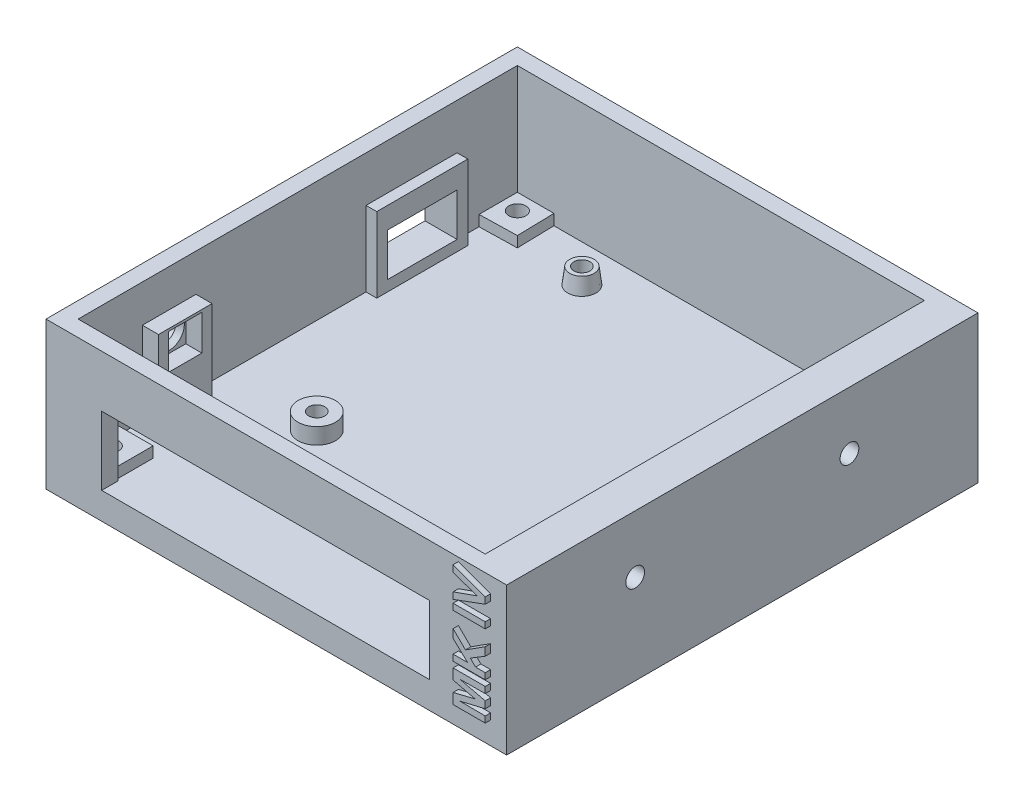
from build123d import *

# Parameters (mm, degrees)
SKETCH1_W            = 82
SKETCH1_H            = 88
BOSS_EXTRUDE1_DEPTH  = 5
SKETCH2_W            = 82
SKETCH2_H            = 88
SKETCH2_W_2          = 76
SKETCH2_H_2          = 82
BOSS_EXTRUDE2_DEPTH  = 22.5
SKETCH_1_R           = 3.5
SKETCH_1_R_2         = 1.5
BOSS_EXTRUDE3_DEPTH  = 3
SKETCH4_W            = 13
SKETCH4_H            = 12
CUT_EXTRUDE1_DEPTH   = 3
SKETCH7_R            = 1.6
CUT_EXTRUDE3_DEPTH   = 67.130552697
CUT_EXTRUDE4_DEPTH   = 3.5
SKETCH10_W           = 17
SKETCH10_H           = 16
SKETCH10_W_2         = 13
SKETCH10_H_2         = 12
BOSS_EXTRUDE6_DEPTH  = 2
CHAMFER1_SIZE        = 10
CHAMFER1_SIZE_2      = 1.227845609
SKETCH11_R           = 1.5
CUT_EXTRUDE5_DEPTH   = 65.212537717
SKETCH12_W           = 61.2
SKETCH12_H           = 12.8
CUT_EXTRUDE6_DEPTH   = 3
SKETCH13_R           = 1.75
CUT_EXTRUDE7_DEPTH   = 3
BOSS_EXTRUDE7_START  = 4
SKETCH14_W           = 88
SKETCH14_H           = 27.5
SKETCH14_R           = 1.75
BOSS_EXTRUDE7_DEPTH  = 4
SKETCH15_R           = 3.75
CUT_EXTRUDE8_DEPTH   = 3
CUT_EXTRUDE9_REACH   = 102.44
SKETCH16_R           = 2.25
SKETCH17_W           = 10
SKETCH17_H           = 15.5
SKETCH17_W_2         = 6.2
SKETCH17_H_2         = 6.6
BOSS_EXTRUDE8_DEPTH  = 3
CHAMFER2_SIZE        = 1
CHAMFER2_SIZE2       = 0.577350269
SKETCH20_R           = 5
SKETCH20_R_2         = 3
BOSS_EXTRUDE10_DEPTH = 1
FILLET3_R            = 2
SKETCH21_W           = 5
SKETCH21_H           = 13
BOSS_EXTRUDE11_DEPTH = 2
SKETCH22_W           = 6
SKETCH22_H           = 1.153846154
BOSS_EXTRUDE12_DEPTH = 1
SKETCH27_W           = 5
SKETCH27_H           = 13
BOSS_EXTRUDE17_DEPTH = 2
SKETCH23_W           = 7
SKETCH23_H           = 7
SKETCH23_R           = 1.6
BOSS_EXTRUDE13_DEPTH = 2
SKETCH25_W           = 17
SKETCH25_H           = 12
SKETCH25_W_2         = 13
SKETCH25_H_2         = 8
BOSS_EXTRUDE15_DEPTH = 1
FILLET4_R            = 2


with BuildPart() as part:
    # Sketch1 → Boss-Extrude1 (new body)
    with BuildSketch(Plane(origin=(0, 0, 0), x_dir=(1, 0, 0), z_dir=(0, 1, 0))):
        Rectangle(SKETCH1_W, SKETCH1_H)
    extrude(amount=BOSS_EXTRUDE1_DEPTH)

    # Sketch2 → Boss-Extrude2 (add)
    with BuildSketch(Plane(origin=(0, 5, 0), x_dir=(1, 0, 0), z_dir=(0, 1, 0))):
        Rectangle(SKETCH2_W, SKETCH2_H)
        Rectangle(SKETCH2_W_2, SKETCH2_H_2, mode=Mode.SUBTRACT)
    extrude(amount=BOSS_EXTRUDE2_DEPTH)

    # Эскиз1 → Boss-Extrude3 (add)
    # profile 1 of 4: a face of its own
    with BuildSketch(Plane(origin=(0, 5, 0), x_dir=(1, 0, 0), z_dir=(0, 1, 0))):
        with Locations(Location((-20.3, -14.15, 0), (0, 0, 90))):
            Circle(SKETCH_1_R)
        with Locations(Location((-20.3, -14.15, 0), (0, 0, 270))):
            Circle(SKETCH_1_R_2, mode=Mode.SUBTRACT)
    # profile 2 of 4: a face of its own
    with BuildSketch(Plane(origin=(0, 5, 0), x_dir=(1, 0, 0), z_dir=(0, 1, 0))):
        with Locations(Location((-19, 34.05, 0), (0, 0, 90))):
            Circle(SKETCH_1_R)
        with Locations(Location((-19, 34.05, 0), (0, 0, 270))):
            Circle(SKETCH_1_R_2, mode=Mode.SUBTRACT)
    # profile 3 of 4: a face of its own
    with BuildSketch(Plane(origin=(0, 5, 0), x_dir=(1, 0, 0), z_dir=(0, 1, 0))):
        with Locations(Location((31.8, 18.85, 0), (0, 0, 90))):
            Circle(SKETCH_1_R)
        with Locations(Location((31.8, 18.85, 0), (0, 0, 270))):
            Circle(SKETCH_1_R_2, mode=Mode.SUBTRACT)
    # profile 4 of 4: a face of its own
    with BuildSketch(Plane(origin=(0, 5, 0), x_dir=(1, 0, 0), z_dir=(0, 1, 0))):
        with Locations(Location((31.8, -9.05, 0), (0, 0, 90))):
            Circle(SKETCH_1_R)
        with Locations(Location((31.8, -9.05, 0), (0, 0, 270))):
            Circle(SKETCH_1_R_2, mode=Mode.SUBTRACT)
    extrude(amount=BOSS_EXTRUDE3_DEPTH)

    # Sketch4 → Cut-Extrude1 (cut)
    with BuildSketch(Plane.ZY.offset(41)):
        with Locations((-21.25, 11)):
            Rectangle(SKETCH4_W, SKETCH4_H)
    extrude(amount=-CUT_EXTRUDE1_DEPTH, mode=Mode.SUBTRACT)

    # Sketch7 → Cut-Extrude3 (cut, through all)
    with BuildSketch(Plane.XZ):
        with Locations(Location((35, -38, 0), (0, 0, 270))):
            Circle(SKETCH7_R)
        with Locations(Location((-35, -38, 0), (0, 0, 270))):
            Circle(SKETCH7_R)
        with Locations(Location((-35, 38, 0), (0, 0, 270))):
            Circle(SKETCH7_R)
        with Locations(Location((35, 38, 0), (0, 0, 270))):
            Circle(SKETCH7_R)
    extrude(amount=-CUT_EXTRUDE3_DEPTH, mode=Mode.SUBTRACT)

    # Sketch8 → Cut-Extrude4 (cut)
    with BuildSketch(Plane.XZ):
        Polygon((33.375, 35.185417438), (36.625, 35.185417438), (38.25, 38), (36.625, 40.814582562), (33.375, 40.814582562), (31.75, 38), align=None)
        Polygon((33.375, -35.185417438), (31.75, -38), (33.375, -40.814582562), (36.625, -40.814582562), (38.25, -38), (36.625, -35.185417438), align=None)
        Polygon((-36.625, -35.185417438), (-38.25, -38), (-36.625, -40.814582562), (-33.375, -40.814582562), (-31.75, -38), (-33.375, -35.185417438), align=None)
        Polygon((-36.625, 35.185417438), (-33.375, 35.185417438), (-31.75, 38), (-33.375, 40.814582562), (-36.625, 40.814582562), (-38.25, 38), align=None)
    extrude(amount=-CUT_EXTRUDE4_DEPTH, mode=Mode.SUBTRACT)

    # Sketch10 → Boss-Extrude6 (add)
    with BuildSketch(Plane(origin=(-38, 0, 0), x_dir=(0, 0, -1), z_dir=(1, 0, 0))):
        with Locations((21.25, 11)):
            Rectangle(SKETCH10_W, SKETCH10_H)
        with Locations((21.25, 11)):
            Rectangle(SKETCH10_W_2, SKETCH10_H_2, mode=Mode.SUBTRACT)
    extrude(amount=BOSS_EXTRUDE6_DEPTH)

    # Chamfer1
    # the kernel refuses this chamfer: 10, 1.227845609 mm, written as the material it takes off along each edge
    with BuildSketch(Plane(origin=(-19, 8, -34.05), x_dir=(0, 0, -1), z_dir=(1, 0, 0))) as chamfer1_piece_1_section:
        Polygon((3.5, -CHAMFER1_SIZE), (3.5 - CHAMFER1_SIZE_2, 0), (3.5, 0), align=None)
    chamfer1_piece_1 = revolve(axis=Axis((-19, 8, -34.05), (0, 1, 0)), mode=Mode.PRIVATE)
    chamfer1_piece_1 = split(chamfer1_piece_1, bisect_by=Plane(origin=(-19, 5, -31.575672909), z_dir=(0, 1, 0)), keep=Keep.TOP, mode=Mode.PRIVATE)
    add(chamfer1_piece_1, mode=Mode.SUBTRACT)

    # Sketch11 → Cut-Extrude5 (cut, through all)
    with BuildSketch(Plane(origin=(0, 5, 0), x_dir=(1, 0, 0), z_dir=(0, 1, 0))):
        with Locations(Location((-20.3, -14.15, 0), (0, 0, 270))):
            Circle(SKETCH11_R)
        with Locations(Location((-19, 34.05, 0), (0, 0, 270))):
            Circle(SKETCH11_R)
        with Locations(Location((31.8, -9.05, 0), (0, 0, 270))):
            Circle(SKETCH11_R)
        with Locations(Location((31.8, 18.85, 0), (0, 0, 270))):
            Circle(SKETCH11_R)
    extrude(amount=-CUT_EXTRUDE5_DEPTH, mode=Mode.SUBTRACT)

    # Sketch12 → Cut-Extrude6 (cut)
    with BuildSketch(Plane.XY.offset(44)):
        with Locations((0, 11.4)):
            Rectangle(SKETCH12_W, SKETCH12_H)
    extrude(amount=-CUT_EXTRUDE6_DEPTH, mode=Mode.SUBTRACT)

    # Sketch13 → Cut-Extrude7 (cut)
    with BuildSketch(Plane(origin=(41, 0, 0), x_dir=(0, 0, -1), z_dir=(1, 0, 0))):
        with Locations((-20, 16.75)):
            Circle(SKETCH13_R)
        with Locations((20, 16.75)):
            Circle(SKETCH13_R)
    extrude(amount=-CUT_EXTRUDE7_DEPTH, mode=Mode.SUBTRACT)

    # Sketch14 → Boss-Extrude7 (add)
    with BuildSketch(Plane(origin=(41, 0, 0), x_dir=(0, 0, -1), z_dir=(1, 0, 0)).offset(BOSS_EXTRUDE7_START)):
        with Locations((0, 13.75)):
            Rectangle(SKETCH14_W, SKETCH14_H)
        with Locations((-20, 16.75)):
            Circle(SKETCH14_R, mode=Mode.SUBTRACT)
        with Locations((20, 16.75)):
            Circle(SKETCH14_R, mode=Mode.SUBTRACT)
    extrude(amount=-BOSS_EXTRUDE7_DEPTH)

    # Sketch15 → Cut-Extrude8 (cut)
    with BuildSketch(Plane.ZY.offset(-38)):
        with Locations((20, 16.75)):
            Circle(SKETCH15_R)
        with Locations((-20, 16.75)):
            Circle(SKETCH15_R)
    extrude(amount=-CUT_EXTRUDE8_DEPTH, mode=Mode.SUBTRACT)

    # Sketch16 → Cut-Extrude9 (cut, up to next)
    with BuildSketch(Plane.ZY.offset(41), mode=Mode.PRIVATE) as cut_extrude9_sk1:
        with Locations((24, 16.75)):
            Circle(SKETCH16_R)
    cut_extrude9_tool1 = extrude(cut_extrude9_sk1.sketch, amount=-CUT_EXTRUDE9_REACH, mode=Mode.PRIVATE) & part.part
    add(cut_extrude9_tool1.solids().sort_by_distance((-41, 16.75, 24))[0], mode=Mode.SUBTRACT)

    # Sketch17 → Boss-Extrude8 (add)
    with BuildSketch(Plane(origin=(-38, 0, 0), x_dir=(0, 0, -1), z_dir=(1, 0, 0))):
        with Locations((-24, 12.75)):
            Rectangle(SKETCH17_W, SKETCH17_H)
        with Locations((-24, 16.75)):
            Rectangle(SKETCH17_W_2, SKETCH17_H_2, mode=Mode.SUBTRACT)
    extrude(amount=BOSS_EXTRUDE8_DEPTH)

    # Chamfer2
    chamfer2_edges = [part.edges().sort_by_distance(p)[0] for p in [
        (-38, 16.75, 21.75),
    ]]
    chamfer2_side = [part.faces().sort_by_distance(p)[0] for p in [
        (-39.5, 16.75, 21.75),
    ]]
    chamfer(chamfer2_edges, length=CHAMFER2_SIZE, length2=CHAMFER2_SIZE2, reference=chamfer2_side[0])

    # Sketch20 → Boss-Extrude10 (add)
    with BuildSketch(Plane.ZY.offset(41)):
        with Locations(Location((24, 16.75, 0), (0, 0, 180))):
            Circle(SKETCH20_R)
        with Locations((24, 16.75)):
            Circle(SKETCH20_R_2, mode=Mode.SUBTRACT)
    extrude(amount=BOSS_EXTRUDE10_DEPTH)

    # Fillet3
    # the kernel refuses this fillet: 2 mm, written as the material it adds along each edge
    with BuildSketch(Plane(origin=(-41, 16.75, 24), x_dir=(0, 0, -1), z_dir=(0, 1, 0))) as fillet3_piece_1:
        with BuildLine():
            CenterArc((6.732050808, 2), FILLET3_R, 210, 60)
            Line((6.732050808, 0), (6.732050808, -0.04))
            Line((6.732050808, -0.04), (5, -0.04))
            Line((5, -0.04), (4.96, 0))
            ThreePointArc((4.96, 0), (4.96, 0.5), (4.965358984, 0.98))
            Line((4.965358984, 0.98), (5, 1))
        make_face()
    revolve(axis=Axis((-41, 16.75, 24), (-1, 0, 0)))

    # Sketch21 → Boss-Extrude11 (add)
    with BuildSketch(Plane(origin=(0, 5, 0), x_dir=(1, 0, 0), z_dir=(0, 1, 0))):
        with Locations((-38.5, 21.25)):
            Rectangle(SKETCH21_W, SKETCH21_H)
    extrude(amount=BOSS_EXTRUDE11_DEPTH)

    # Sketch22 → Boss-Extrude12 (add)
    with BuildSketch(Plane.XY.offset(44)):
        Polygon((42, 4.173076923), (36, 4.173076923), (36, 6.125), (40.092548077, 7.134615385), (36, 8.144230769), (36, 10.096153846), (42, 10.096153846), (42, 8.942307692), (37.276442308, 8.903846154), (42, 7.777644231), (42, 6.491586538), (37.276442308, 5.365384615), (42, 5.326923077), align=None)
        Polygon((42, 11.173076923), (36, 11.173076923), (36, 12.326923077), (38.686298077, 12.326923077), (36, 14.856971154), (36, 16.442307692), (38.319711538, 14.163461538), (42, 16.519230769), (42, 14.981971154), (39.212740385, 13.288461538), (40.191105769, 12.326923077), (42, 12.326923077), align=None)
        with Locations((39, 19.980769231)):
            Rectangle(SKETCH22_W, SKETCH22_H)
        Polygon((42, 23.391826923), (36, 21.173076923), (36, 22.391826923), (40.461538462, 23.980769231), (36, 25.563701923), (36, 26.788461538), (42, 24.578125), align=None)
    extrude(amount=BOSS_EXTRUDE12_DEPTH)

    # Sketch27 → Boss-Extrude17 (add)
    with BuildSketch(Plane.XZ.offset(-17)):
        with Locations((-38.5, -21.25)):
            Rectangle(SKETCH27_W, SKETCH27_H)
    extrude(amount=BOSS_EXTRUDE17_DEPTH)

    # Sketch23 → Boss-Extrude13 (add)
    # profile 1 of 4: a face of its own
    with BuildSketch(Plane(origin=(0, 5, 0), x_dir=(1, 0, 0), z_dir=(0, 1, 0))):
        with Locations((-34.5, -37.5)):
            Rectangle(SKETCH23_W, SKETCH23_H)
        with Locations(Location((-35, -38, 0), (0, 0, 90))):
            Circle(SKETCH23_R, mode=Mode.SUBTRACT)
    # profile 2 of 4: a face of its own
    with BuildSketch(Plane(origin=(0, 5, 0), x_dir=(1, 0, 0), z_dir=(0, 1, 0))):
        with Locations((34.5, -37.5)):
            Rectangle(SKETCH23_W, SKETCH23_H)
        with Locations(Location((35, -38, 0), (0, 0, 90))):
            Circle(SKETCH23_R, mode=Mode.SUBTRACT)
    # profile 3 of 4: a face of its own
    with BuildSketch(Plane(origin=(0, 5, 0), x_dir=(1, 0, 0), z_dir=(0, 1, 0))):
        with Locations((34.5, 37.5)):
            Rectangle(SKETCH23_W, SKETCH23_H)
        with Locations(Location((35, 38, 0), (0, 0, 90))):
            Circle(SKETCH23_R, mode=Mode.SUBTRACT)
    # profile 4 of 4: a face of its own
    with BuildSketch(Plane(origin=(0, 5, 0), x_dir=(1, 0, 0), z_dir=(0, 1, 0))):
        Polygon((-38, 33.837921002), (-31.001921416, 34.001921416), (-31.16592183, 41), (-38, 41), align=None)
        with Locations(Location((-35, 38, 0), (0, 0, 90))):
            Circle(SKETCH23_R, mode=Mode.SUBTRACT)
    extrude(amount=BOSS_EXTRUDE13_DEPTH)

    # Sketch25 → Boss-Extrude15 (add)
    with BuildSketch(Plane.ZY.offset(41)):
        with Locations((-21.25, 11)):
            Rectangle(SKETCH25_W, SKETCH25_H)
        with Locations((-21.25, 11)):
            Rectangle(SKETCH25_W_2, SKETCH25_H_2, mode=Mode.SUBTRACT)
    extrude(amount=BOSS_EXTRUDE15_DEPTH)

    # Fillet4
    # the kernel refuses this fillet: 2 mm, written as the material it adds along each edge
    with BuildSketch(Plane(origin=(-41, 17, -29.75), x_dir=(0, 1, 0), z_dir=(0, 0, 1)), Plane(origin=(-41, 5, -12.75), x_dir=(0, -1, 0), z_dir=(0, 0, -1))) as fillet4_piece_1:
        with BuildLine():
            CenterArc((1.732050808, 2), FILLET4_R, 210, 60)
            Line((0, 1), (-0.034641016, 0.98))
            ThreePointArc((-0.034641016, 0.98), (-0.04, 0.5), (-0.04, 0))
            Line((-0.04, 0), (0, -0.04))
            Line((0, -0.04), (1.732050808, -0.04))
            Line((1.732050808, -0.04), (1.732050808, 0))
        make_face()
    extrude(amount=17)
    with BuildSketch(Plane(origin=(-41, 5, -29.75), x_dir=(0, 0, -1), z_dir=(0, 1, 0)), Plane(origin=(-41, 17, -12.75), x_dir=(0, 0, 1), z_dir=(0, -1, 0))) as fillet4_piece_2:
        with BuildLine():
            CenterArc((1.732050808, 2), FILLET4_R, 210, 60)
            Line((0, 1), (-0.034641016, 0.98))
            ThreePointArc((-0.034641016, 0.98), (-0.04, 0.5), (-0.04, 0))
            Line((-0.04, 0), (0, -0.04))
            Line((0, -0.04), (1.732050808, -0.04))
            Line((1.732050808, -0.04), (1.732050808, 0))
        make_face()
    extrude(amount=12)
    with BuildSketch(Plane(origin=(-41, 5, -29.75), x_dir=(0, 0, -1), z_dir=(0, 1, 0))) as fillet4_piece_3a_section:
        with BuildLine():
            CenterArc((1.732050808, 2), FILLET4_R, 210, 60)
            Line((0, 1), (-0.034641016, 0.98))
            ThreePointArc((-0.034641016, 0.98), (-0.04, 0.5), (-0.04, 0))
            Line((-0.04, 0), (0, -0.04))
            Line((0, -0.04), (1.732050808, -0.04))
            Line((1.732050808, -0.04), (1.732050808, 0))
        make_face()
    fillet4_piece_3a = extrude(amount=16.330127019, mode=Mode.PRIVATE)
    fillet4_piece_3a = split(fillet4_piece_3a, bisect_by=Plane(origin=(-41.259033422, 17, -30.182620892), z_dir=(0, 1, 0)), keep=Keep.TOP, mode=Mode.PRIVATE)
    with BuildSketch(Plane(origin=(-41, 17, -34.080127019), x_dir=(0, 1, 0), z_dir=(0, 0, 1))) as fillet4_piece_3b_section:
        with BuildLine():
            CenterArc((1.732050808, 2), FILLET4_R, 210, 60)
            Line((0, 1), (-0.034641016, 0.98))
            ThreePointArc((-0.034641016, 0.98), (-0.04, 0.5), (-0.04, 0))
            Line((-0.04, 0), (0, -0.04))
            Line((0, -0.04), (1.732050808, -0.04))
            Line((1.732050808, -0.04), (1.732050808, 0))
        make_face()
    fillet4_piece_3b = extrude(amount=21.330127019, mode=Mode.PRIVATE)
    fillet4_piece_3b = split(fillet4_piece_3b, bisect_by=Plane(origin=(-41.259033422, 17.432620892, -29.75), z_dir=(0, 0, -1)), keep=Keep.TOP, mode=Mode.PRIVATE)
    fillet4_piece_3 = fillet4_piece_3a & fillet4_piece_3b
    add(fillet4_piece_3)
    with BuildSketch(Plane(origin=(-41, 17, -29.75), x_dir=(0, 1, 0), z_dir=(0, 0, 1))) as fillet4_piece_4a_section:
        with BuildLine():
            CenterArc((1.732050808, 2), FILLET4_R, 210, 60)
            Line((0, 1), (-0.034641016, 0.98))
            ThreePointArc((-0.034641016, 0.98), (-0.04, 0.5), (-0.04, 0))
            Line((-0.04, 0), (0, -0.04))
            Line((0, -0.04), (1.732050808, -0.04))
            Line((1.732050808, -0.04), (1.732050808, 0))
        make_face()
    fillet4_piece_4a = extrude(amount=21.330127019, mode=Mode.PRIVATE)
    fillet4_piece_4a = split(fillet4_piece_4a, bisect_by=Plane(origin=(-41.259033422, 17.432620892, -12.75), z_dir=(0, 0, 1)), keep=Keep.TOP, mode=Mode.PRIVATE)
    with BuildSketch(Plane(origin=(-41, 21.330127019, -12.75), x_dir=(0, 0, 1), z_dir=(0, -1, 0))) as fillet4_piece_4b_section:
        with BuildLine():
            CenterArc((1.732050808, 2), FILLET4_R, 210, 60)
            Line((0, 1), (-0.034641016, 0.98))
            ThreePointArc((-0.034641016, 0.98), (-0.04, 0.5), (-0.04, 0))
            Line((-0.04, 0), (0, -0.04))
            Line((0, -0.04), (1.732050808, -0.04))
            Line((1.732050808, -0.04), (1.732050808, 0))
        make_face()
    fillet4_piece_4b = extrude(amount=16.330127019, mode=Mode.PRIVATE)
    fillet4_piece_4b = split(fillet4_piece_4b, bisect_by=Plane(origin=(-41.259033422, 17, -12.317379108), z_dir=(0, 1, 0)), keep=Keep.TOP, mode=Mode.PRIVATE)
    fillet4_piece_4 = fillet4_piece_4a & fillet4_piece_4b
    add(fillet4_piece_4)
    with BuildSketch(Plane(origin=(-41, 5, -12.75), x_dir=(0, -1, 0), z_dir=(0, 0, -1))) as fillet4_piece_5a_section:
        with BuildLine():
            CenterArc((1.732050808, 2), FILLET4_R, 210, 60)
            Line((0, 1), (-0.034641016, 0.98))
            ThreePointArc((-0.034641016, 0.98), (-0.04, 0.5), (-0.04, 0))
            Line((-0.04, 0), (0, -0.04))
            Line((0, -0.04), (1.732050808, -0.04))
            Line((1.732050808, -0.04), (1.732050808, 0))
        make_face()
    fillet4_piece_5a = extrude(amount=21.330127019, mode=Mode.PRIVATE)
    fillet4_piece_5a = split(fillet4_piece_5a, bisect_by=Plane(origin=(-41.259033422, 4.567379108, -29.75), z_dir=(0, 0, -1)), keep=Keep.TOP, mode=Mode.PRIVATE)
    with BuildSketch(Plane(origin=(-41, 0.669872981, -29.75), x_dir=(0, 0, -1), z_dir=(0, 1, 0))) as fillet4_piece_5b_section:
        with BuildLine():
            CenterArc((1.732050808, 2), FILLET4_R, 210, 60)
            Line((0, 1), (-0.034641016, 0.98))
            ThreePointArc((-0.034641016, 0.98), (-0.04, 0.5), (-0.04, 0))
            Line((-0.04, 0), (0, -0.04))
            Line((0, -0.04), (1.732050808, -0.04))
            Line((1.732050808, -0.04), (1.732050808, 0))
        make_face()
    fillet4_piece_5b = extrude(amount=16.330127019, mode=Mode.PRIVATE)
    fillet4_piece_5b = split(fillet4_piece_5b, bisect_by=Plane(origin=(-41.259033422, 5, -30.182620892), z_dir=(0, -1, 0)), keep=Keep.TOP, mode=Mode.PRIVATE)
    fillet4_piece_5 = fillet4_piece_5a & fillet4_piece_5b
    add(fillet4_piece_5)
    with BuildSketch(Plane(origin=(-41, 5, -8.419872981), x_dir=(0, -1, 0), z_dir=(0, 0, -1))) as fillet4_piece_6a_section:
        with BuildLine():
            CenterArc((1.732050808, 2), FILLET4_R, 210, 60)
            Line((0, 1), (-0.034641016, 0.98))
            ThreePointArc((-0.034641016, 0.98), (-0.04, 0.5), (-0.04, 0))
            Line((-0.04, 0), (0, -0.04))
            Line((0, -0.04), (1.732050808, -0.04))
            Line((1.732050808, -0.04), (1.732050808, 0))
        make_face()
    fillet4_piece_6a = extrude(amount=21.330127019, mode=Mode.PRIVATE)
    fillet4_piece_6a = split(fillet4_piece_6a, bisect_by=Plane(origin=(-41.259033422, 4.567379108, -12.75), z_dir=(0, 0, 1)), keep=Keep.TOP, mode=Mode.PRIVATE)
    with BuildSketch(Plane(origin=(-41, 17, -12.75), x_dir=(0, 0, 1), z_dir=(0, -1, 0))) as fillet4_piece_6b_section:
        with BuildLine():
            CenterArc((1.732050808, 2), FILLET4_R, 210, 60)
            Line((0, 1), (-0.034641016, 0.98))
            ThreePointArc((-0.034641016, 0.98), (-0.04, 0.5), (-0.04, 0))
            Line((-0.04, 0), (0, -0.04))
            Line((0, -0.04), (1.732050808, -0.04))
            Line((1.732050808, -0.04), (1.732050808, 0))
        make_face()
    fillet4_piece_6b = extrude(amount=16.330127019, mode=Mode.PRIVATE)
    fillet4_piece_6b = split(fillet4_piece_6b, bisect_by=Plane(origin=(-41.259033422, 5, -12.317379108), z_dir=(0, -1, 0)), keep=Keep.TOP, mode=Mode.PRIVATE)
    fillet4_piece_6 = fillet4_piece_6a & fillet4_piece_6b
    add(fillet4_piece_6)


solid = part.part
